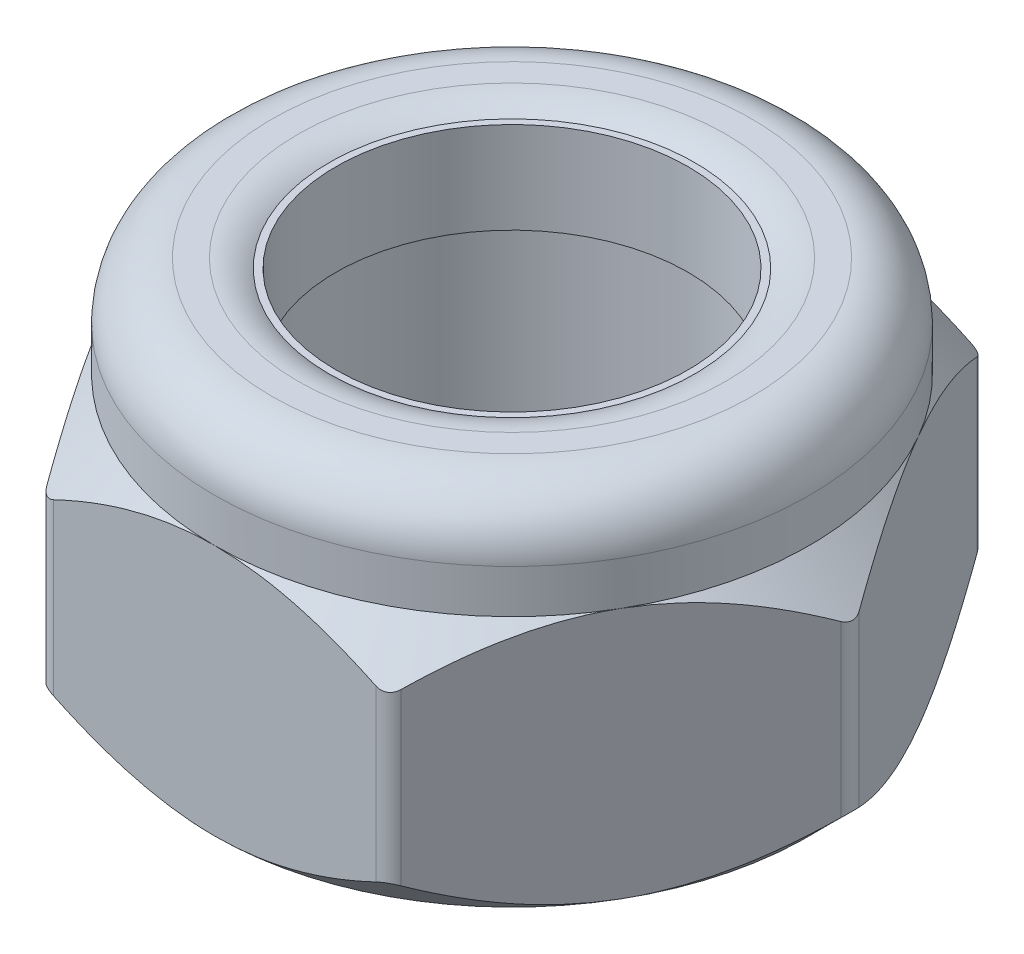
from build123d import *

# Parameters (mm, degrees)
EXTRUDE_1_DEPTH     = 2.75
SKETCH_3_R          = 6.5
EXTRUDE_2_DEPTH     = 2.2
SKETCH_4_R          = 4
CUT_EXTRUDE_1_DEPTH = 13.56476555
EXTRUDE_START       = -0.2
SKETCH_5_R          = 4
SKETCH_5_R_2        = 3.85
EXTRUDE_3_DEPTH     = 2
FILLET_1_R          = 1.25
FILLET_3_R          = 0.4


with BuildPart() as part:
    # 草图1 → 凸台-拉伸1 (new, symmetric)
    with BuildSketch(Plane(origin=(0, 0, 0), x_dir=(1, 0, 0), z_dir=(0, 1, 0))):
        Polygon((7.505553499, 0), (3.75277675, 6.5), (-3.75277675, 6.5), (-7.505553499, 0), (-3.75277675, -6.5), (3.75277675, -6.5), align=None)
    extrude(amount=EXTRUDE_1_DEPTH, both=True)

    # 草图3 → 凸台-拉伸2 (add)
    with BuildSketch(Plane(origin=(0, 2.75, 0), x_dir=(1, 0, 0), z_dir=(0, 1, 0))):
        with Locations(Location((0, 0, 0), (0, 0, 270))):
            Circle(SKETCH_3_R)
    extrude(amount=EXTRUDE_2_DEPTH)

    # 草图4 → 切除-拉伸1 (cut, through all)
    with BuildSketch(Plane(origin=(0, 4.95, 0), x_dir=(1, 0, 0), z_dir=(0, 1, 0))):
        with Locations(Location((0, 0, 0), (0, 0, 270))):
            Circle(SKETCH_4_R)
    extrude(amount=-CUT_EXTRUDE_1_DEPTH, mode=Mode.SUBTRACT)

    # 草图5 → 凸台-拉伸3 (add)
    with BuildSketch(Plane(origin=(0, 4.95, 0), x_dir=(1, 0, 0), z_dir=(0, 1, 0)).offset(EXTRUDE_START)):
        with Locations(Location((0, 0, 0), (0, 0, 270))):
            Circle(SKETCH_5_R)
        with Locations(Location((0, 0, 0), (0, 0, 270))):
            Circle(SKETCH_5_R_2, mode=Mode.SUBTRACT)
    extrude(amount=-EXTRUDE_3_DEPTH)

    # 圆角1
    # the kernel refuses this fillet: 1.25 mm, written as the material it takes off along each edge
    with BuildSketch(Plane(origin=(0, 4.95, 0), x_dir=(0, 0, 1), z_dir=(-1, 0, 0))) as fillet_1_piece_1:
        with BuildLine():
            CenterArc((6.5 - FILLET_1_R, -FILLET_1_R), FILLET_1_R, 0, 90)
            Line((6.5 - FILLET_1_R, 0), (6.5 - FILLET_1_R, FILLET_1_R * 0.02))
            Line((6.5 - FILLET_1_R, FILLET_1_R * 0.02), (6.5 + FILLET_1_R * 0.02, FILLET_1_R * 0.02))
            Line((6.5 + FILLET_1_R * 0.02, FILLET_1_R * 0.02), (6.5 + FILLET_1_R * 0.02, -FILLET_1_R))
            Line((6.5 + FILLET_1_R * 0.02, -FILLET_1_R), (6.5, -FILLET_1_R))
        make_face()
    revolve(axis=Axis((0, 4.95, 0), (0, 1, 0)), mode=Mode.SUBTRACT)
    with BuildSketch(Plane(origin=(0, 4.95, 0), x_dir=(0, 0, 1), z_dir=(-1, 0, 0))) as fillet_1_piece_2:
        with BuildLine():
            CenterArc((4.678232998, -1.25), FILLET_1_R, 90, 32.859880379)
            Line((4, -0.2), (3.98643534, -0.179))
            ThreePointArc((3.98643534, -0.179), (3.975, -0.1), (3.975, 0))
            Line((3.975, 0), (4, 0.025))
            Line((4, 0.025), (4.678232998, 0.025))
            Line((4.678232998, 0.025), (4.678232998, 0))
        make_face()
    revolve(axis=Axis((0, 4.95, 0), (0, 1, 0)), mode=Mode.SUBTRACT)

    # 草图6 → 切除-旋转1 (revolve, cut)
    with BuildSketch(Plane.XY):
        Polygon((-7.505553499, 2.75), (-7.505553499, 1.744446501), (-6.5, 2.75), align=None)
        Polygon((-7.505553499, -2.75), (-7.505553499, -1.744446501), (-6.5, -2.75), align=None)
    revolve(axis=Axis((0, -1000, 0), (0, 1, 0)), mode=Mode.SUBTRACT)

    # 圆角3
    fillet_3_edges = [part.edges().sort_by_distance(p)[0] for p in [
        (-7.505553499, 0, 0),
        (-3.75277675, 0, -6.5),
        (3.75277675, 0, -6.5),
        (7.505553499, 0, 0),
        (3.75277675, 0, 6.5),
        (-3.75277675, 0, 6.5),
    ]]
    fillet(fillet_3_edges, radius=FILLET_3_R)


solid = part.part
